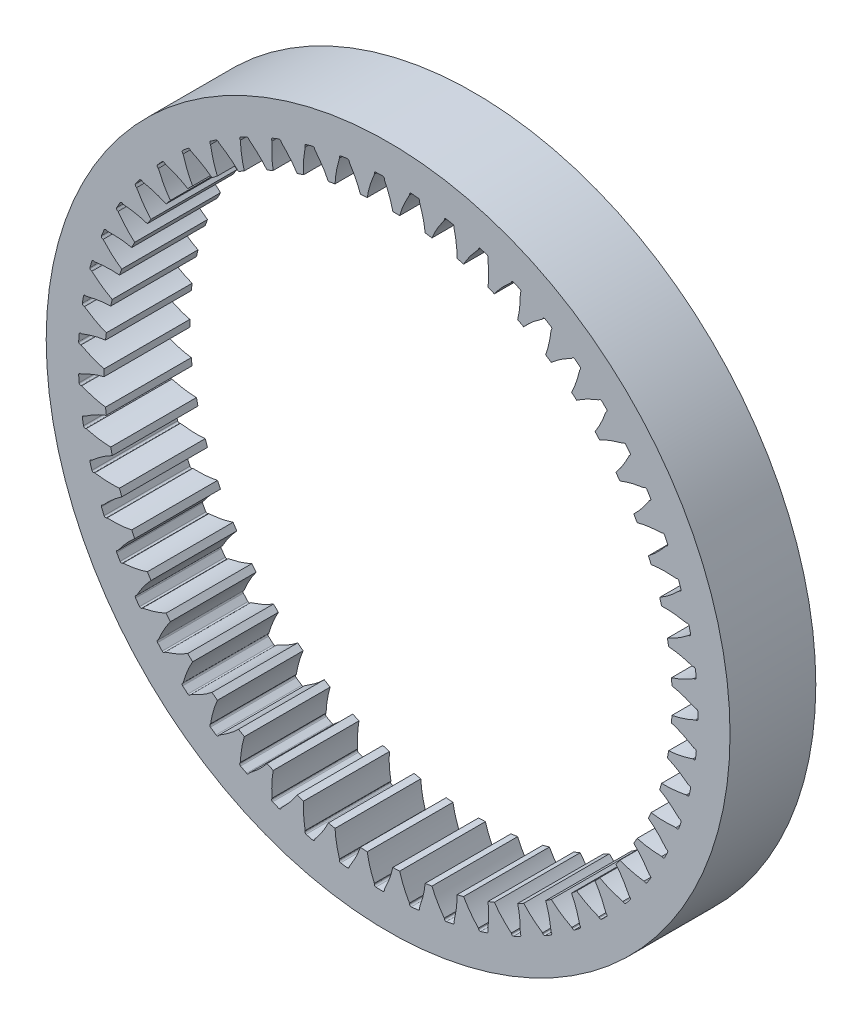
from build123d import *

# Parameters (mm, degrees)
BLANK_SKETCH_R    = 39.875
BLANK_SKETCH_R_2  = 33.125
BLANK_DEPTH       = 10
TOOTH_SPACE_DEPTH = 58.271557077
TEETH_COUNT       = 55


with BuildPart() as part:
    # Blank Sketch → Blank (new body)
    with BuildSketch(Plane.XY):
        Circle(BLANK_SKETCH_R)
        Circle(BLANK_SKETCH_R_2, mode=Mode.SUBTRACT)
    extrude(amount=BLANK_DEPTH)

    # Tooth Space Sketch → Tooth Space (cut, symmetric)
    with BuildSketch(Plane.XY):
        with BuildLine():
            Line((32.461834745, 1.574574547), (31.837568692, 1.544294268))
            Line((31.837568692, 1.544294268), (31.837568692, -1.544294268))
            Line((31.837568692, -1.544294268), (32.461834745, -1.574574547))
            add(Edge.make_bspline(
                [(32.461834745, -1.574574547), (32.477967006, -1.573573208), (32.510891188, -1.57127216), (32.587413378, -1.565266138), (32.670305956, -1.556547614), (32.776126837, -1.544113284), (32.88177392, -1.52912144), (32.991879813, -1.511957331), (33.098958433, -1.493253974), (33.207382709, -1.472820083), (33.314492465, -1.450988516), (33.421991278, -1.427621424), (33.55216243, -1.39763011), (33.709227477, -1.358748173), (33.890835661, -1.310425938), (34.099660287, -1.249847534), (34.3074711, -1.185487463), (34.518473294, -1.115141605), (34.721045912, -1.044362482), (34.934008608, -0.96466646), (35.126525881, -0.890428202), (35.349331367, -0.798404092), (35.518556287, -0.727393927), (35.709535964, -0.641920293), (35.794975641, -0.603093963), (35.839011852, -0.582789452)],
                knots=[0.027603686, 0.027603686, 0.027603686, 0.027603686, 0.027603686, 0.04588116, 0.064917983, 0.092335275, 0.119752856, 0.147169869, 0.174587361, 0.202004624, 0.229421871, 0.256839297, 0.284256477, 0.311673811, 0.363254706, 0.418089376, 0.472923867, 0.527758361, 0.582592988, 0.637427473, 0.692262011, 0.747096564, 0.801931187, 0.856765725, 0.911600339, 0.911600339, 0.911600339, 0.911600339, 0.911600339], degree=4))
            Line((35.839011852, -0.582789452), (35.93226039, -0.584305796))
            ThreePointArc((35.93226039, -0.584305796), (36.066069301, -0.531210601), (36.122797552, -0.398901002))
            ThreePointArc((36.122797552, -0.398901002), (36.125, 0), (36.122797552, 0.398901002))
            ThreePointArc((36.122797552, 0.398901002), (36.066069301, 0.531210601), (35.93226039, 0.584305796))
            Line((35.93226039, 0.584305796), (35.839011852, 0.582789452))
            add(Edge.make_bspline(
                [(32.461834745, 1.574574547), (32.477967006, 1.573573208), (32.510891188, 1.57127216), (32.587413378, 1.565266138), (32.670305956, 1.556547614), (32.776126837, 1.544113284), (32.88177392, 1.52912144), (32.991879813, 1.511957331), (33.098958433, 1.493253974), (33.207382709, 1.472820083), (33.314492465, 1.450988516), (33.421991278, 1.427621424), (33.55216243, 1.39763011), (33.709227477, 1.358748173), (33.890835661, 1.310425938), (34.099660287, 1.249847534), (34.3074711, 1.185487463), (34.518473294, 1.115141605), (34.721045912, 1.044362482), (34.934008608, 0.96466646), (35.126525881, 0.890428202), (35.349331367, 0.798404092), (35.518556287, 0.727393927), (35.709535964, 0.641920293), (35.794975641, 0.603093963), (35.839011852, 0.582789452)],
                knots=[0.027603686, 0.027603686, 0.027603686, 0.027603686, 0.027603686, 0.04588116, 0.064917983, 0.092335275, 0.119752856, 0.147169869, 0.174587361, 0.202004624, 0.229421871, 0.256839297, 0.284256477, 0.311673811, 0.363254706, 0.418089376, 0.472923867, 0.527758361, 0.582592988, 0.637427473, 0.692262011, 0.747096564, 0.801931187, 0.856765725, 0.911600339, 0.911600339, 0.911600339, 0.911600339, 0.911600339], degree=4))
        make_face()
    tooth_space = extrude(amount=TOOTH_SPACE_DEPTH, both=True, mode=Mode.SUBTRACT)

    # Teeth: Tooth Space ×55 about axis
    teeth_axis = Axis((0, 0, -0.50007105), (0, 0, 1))
    for i in range(1, TEETH_COUNT):
        add(tooth_space.rotate(teeth_axis, i * 360 / TEETH_COUNT), mode=Mode.SUBTRACT)


solid = part.part
